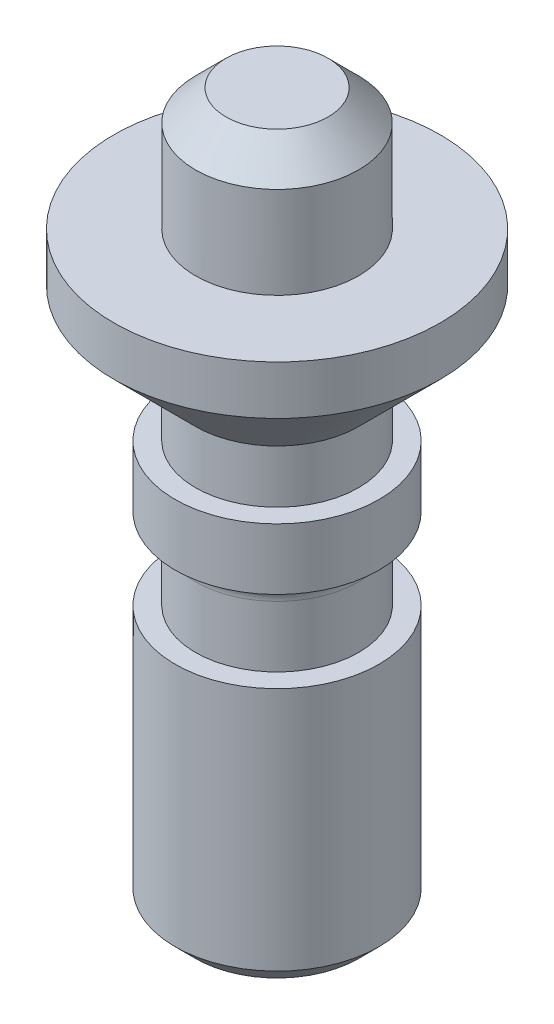
from build123d import *

# Parameters (mm, degrees)
FILLET1_R           = 0.5
CHAMFER1_SIZE       = 0.5
CHAMFER2_SIZE       = 0.75
SKETCH4_R           = 1.5
CUT_EXTRUDE2_DEPTH  = 8.5
BOSS_EXTRUDE1_DEPTH = 8.5
CIRPATTERN1_COUNT   = 4


with BuildPart() as part:
    # Sketch1 → Revolve1 (revolve)
    with BuildSketch(Plane.XY):
        Polygon((0, 0), (2.5, 0), (2.5, 6.5), (2, 6.5), (2, 8.5), (2.5, 8.5), (2.5, 10), (2, 10), (2, 11.3), (4, 13.3), (4, 14.5), (2, 14.5), (2, 17.5), (0, 17.5), align=None)
    revolve(axis=Axis((0, -103.420301815, 0), (0, 1, 0)))

    # Fillet1
    fillet1_edges = [part.edges().sort_by_distance(p)[0] for p in [
        (-2, 8.5, 0),
    ]]
    fillet(fillet1_edges, radius=FILLET1_R - 0.0001)  # a hair under: the kernel refuses the full size

    # Chamfer1
    chamfer1_edges = [part.edges().sort_by_distance(p)[0] for p in [
        (-2.5, 0, 0),
    ]]
    chamfer(chamfer1_edges, length=CHAMFER1_SIZE)

    # Chamfer2
    chamfer2_edges = [part.edges().sort_by_distance(p)[0] for p in [
        (-2, 17.5, 0),
    ]]
    chamfer(chamfer2_edges, length=CHAMFER2_SIZE)

    # Sketch4 → Cut-Extrude2 (cut)
    with BuildSketch(Plane.XZ):
        Circle(SKETCH4_R)
    extrude(amount=-CUT_EXTRUDE2_DEPTH, mode=Mode.SUBTRACT)

    # Sketch6 → Boss-Extrude1 (add)
    with BuildSketch(Plane.XZ):
        with BuildLine():
            Line((-0.5, 1.414213562), (-0.5, 1.145643924))
            ThreePointArc((-0.5, 1.145643924), (0, 1.25), (0.5, 1.145643924))
            Line((0.5, 1.145643924), (0.5, 1.414213562))
            ThreePointArc((0.5, 1.414213562), (0, 1.5), (-0.5, 1.414213562))
        make_face()
    boss_extrude1 = extrude(amount=-BOSS_EXTRUDE1_DEPTH)

    # CirPattern1: Boss-Extrude1 ×4 about axis
    cirpattern1_axis = Axis((0, 0, 0), (0, 1, 0))
    for i in range(1, CIRPATTERN1_COUNT):
        add(boss_extrude1.rotate(cirpattern1_axis, i * 360 / CIRPATTERN1_COUNT))


solid = part.part
